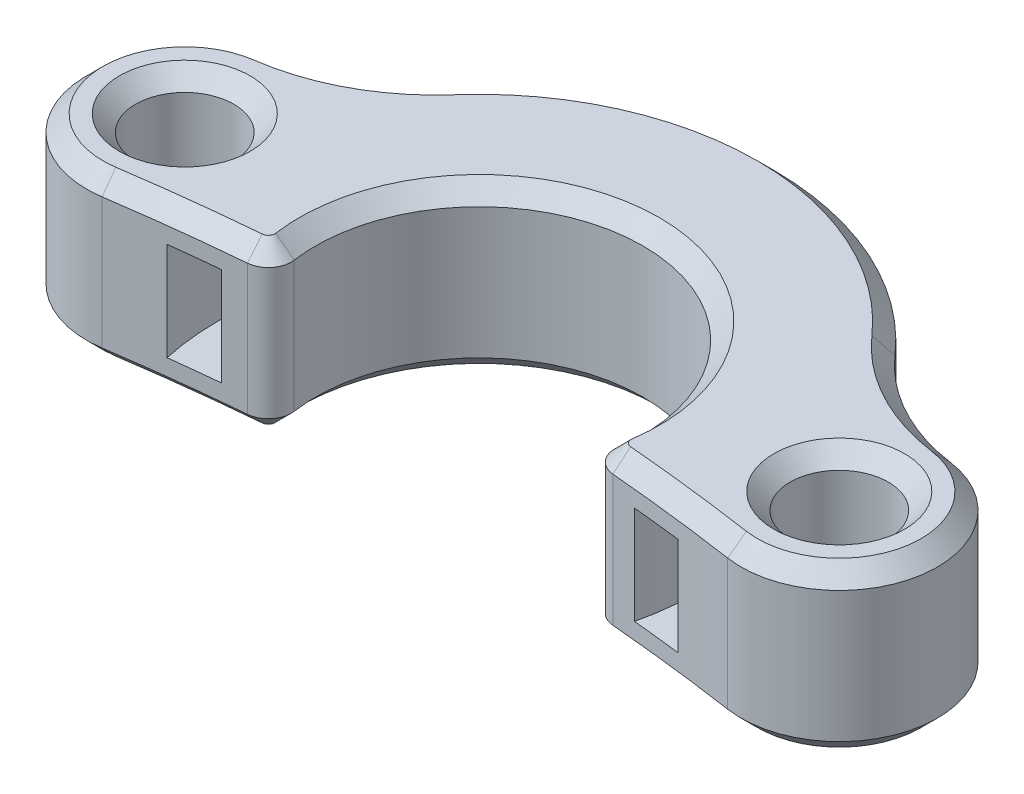
from build123d import *

# Parameters (mm, degrees)
SKETCH1_R           = 1.5
BOSS_EXTRUDE1_DEPTH = 5
SKETCH2_W           = 1.5
SKETCH2_H           = 3
FILLET1_R           = 0.7
CHAMFER1_SIZE       = 0.5


with BuildPart() as part:
    # Sketch1 → Boss-Extrude1 (new body)
    with BuildSketch(Plane(origin=(0, 0, 0), x_dir=(1, 0, 0), z_dir=(0, 1, 0))):
        with BuildLine():
            ThreePointArc((-10.419615786, 2.97050881), (-12.968965599, -0.430398965), (-9.558823529, -2.967383245))
            ThreePointArc((-9.558823529, -2.967383245), (-7.178780537, -2.658325394), (-4.78895041, -2.437342678))
            ThreePointArc((-4.78895041, -2.437342678), (0, 4), (4.78895041, -2.437342678))
            ThreePointArc((4.78895041, -2.437342678), (7.178780537, -2.658325394), (9.558823529, -2.967383245))
            ThreePointArc((9.558823529, -2.967383245), (12.968965599, -0.430398965), (10.419615786, 2.97050881))
            ThreePointArc((10.419615786, 2.97050881), (8.410541651, 3.630697462), (6.755308414, 4.946915859))
            ThreePointArc((6.755308414, 4.946915859), (0, 8), (-6.755308414, 4.946915859))
            ThreePointArc((-6.755308414, 4.946915859), (-8.410541651, 3.630697462), (-10.419615786, 2.97050881))
        make_face()
        with Locations((-10, 0)):
            Circle(SKETCH1_R, mode=Mode.SUBTRACT)
        with Locations((10, 0)):
            Circle(SKETCH1_R, mode=Mode.SUBTRACT)
    extrude(amount=BOSS_EXTRUDE1_DEPTH)

    # Sketch2 → Cut-Revolve1 (revolve, cut)
    with BuildSketch(Plane(origin=(0, 0, 0), x_dir=(0, 0, -1), z_dir=(1, 0, 0))):
        with Locations((6.25, 2.5)):
            Rectangle(SKETCH2_W, SKETCH2_H)
    revolve(axis=Axis((0, 0, 1), (0, 1, 0)), mode=Mode.SUBTRACT)

    # Fillet1
    fillet1_edges = [part.edges().sort_by_distance(p)[0] for p in [
        (4.78895041, 2.5, 2.437342678),
        (-4.78895041, 2.5, 2.437342678),
    ]]
    fillet(fillet1_edges, radius=FILLET1_R)

    # Chamfer1
    chamfer1_edges = [part.edges().sort_by_distance(p)[0] for p in [
        (-11.5, 0, 0),
        (8.5, 0, 0),
        (12.968965599, 0, 0.430398965),
        (8.410541651, 0, -3.630697462),
        (0, 0, -8),
        (-8.410541651, 0, -3.630697462),
        (-12.968965599, 0, 0.430398965),
        (-7.574484517, 0, 2.703524738),
        (-5.095142782, 0, 2.239095584),
        (0, 0, -4),
        (5.095142782, 0, 2.239095584),
        (7.574484517, 0, 2.703524738),
        (-11.5, 5, 0),
        (8.5, 5, 0),
        (-5.095142782, 5, 2.239095584),
        (-7.574484517, 5, 2.703524738),
        (-12.968965599, 5, 0.430398965),
        (-8.410541651, 5, -3.630697462),
        (0, 5, -8),
        (8.410541651, 5, -3.630697462),
        (12.968965599, 5, 0.430398965),
        (7.574484517, 5, 2.703524738),
        (5.095142782, 5, 2.239095584),
        (0, 5, -4),
    ]]
    chamfer(chamfer1_edges, length=CHAMFER1_SIZE)


solid = part.part
